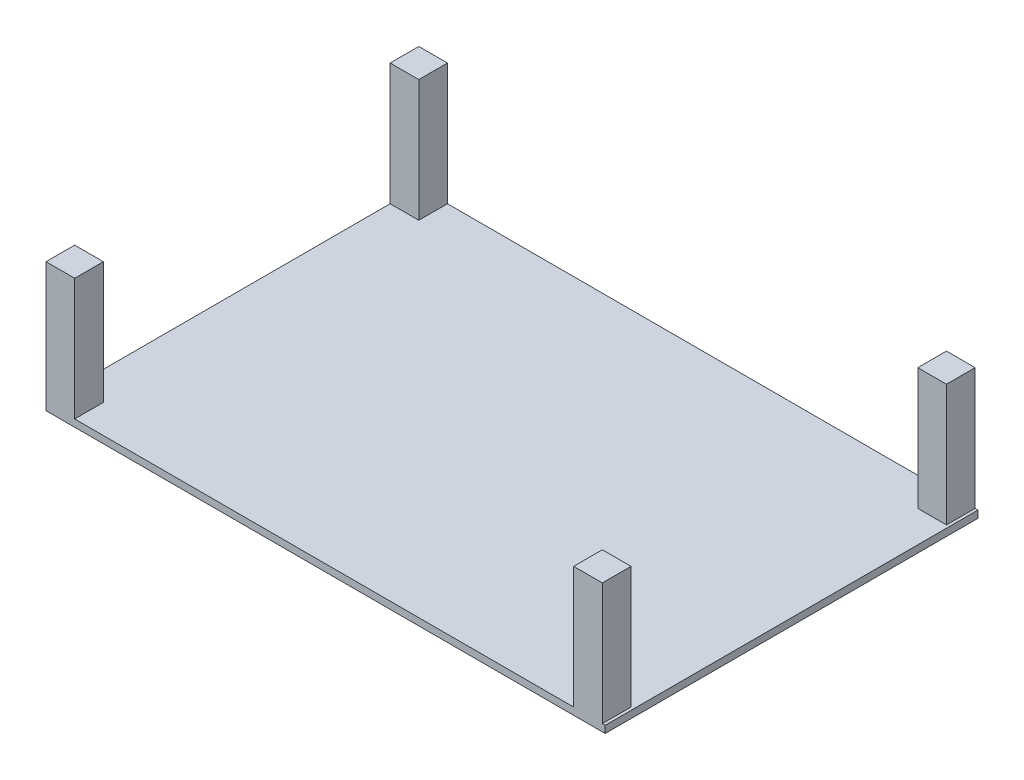
from build123d import *

# Parameters (mm, degrees)
SKETCH2_W            = 247.65
SKETCH2_H            = 165.1
BOSS_EXTRUDE1_DEPTH  = 3.175
SKETCH3_W            = 12.7
SKETCH3_H            = 12.7
BOSS_EXTRUDE2_DEPTH  = 53.975
LPATTERN1_COUNT      = 2
LPATTERN1_PITCH      = 152.4
LPATTERN1_COUNT_DIR2 = 2
LPATTERN1_PITCH_DIR2 = 233.68


with BuildPart() as part:
    # Sketch2 → Boss-Extrude1 (new body)
    with BuildSketch(Plane(origin=(0, 0, 0), x_dir=(1, 0, 0), z_dir=(0, 1, 0))):
        Rectangle(SKETCH2_W, SKETCH2_H)
    extrude(amount=BOSS_EXTRUDE1_DEPTH)

    # Sketch3 → Boss-Extrude2 (add)
    with BuildSketch(Plane(origin=(0, 3.175, 0), x_dir=(1, 0, 0), z_dir=(0, 1, 0))):
        with Locations((-117.475, -76.2)):
            Rectangle(SKETCH3_W, SKETCH3_H)
    boss_extrude2 = extrude(amount=BOSS_EXTRUDE2_DEPTH)

    # LPattern1: Boss-Extrude2 2 × 2
    with Locations(*[(j * LPATTERN1_PITCH_DIR2, 0, -i * LPATTERN1_PITCH) for i in range(LPATTERN1_COUNT) for j in range(LPATTERN1_COUNT_DIR2) if (i, j) != (0, 0)]):
        add(boss_extrude2)


solid = part.part
